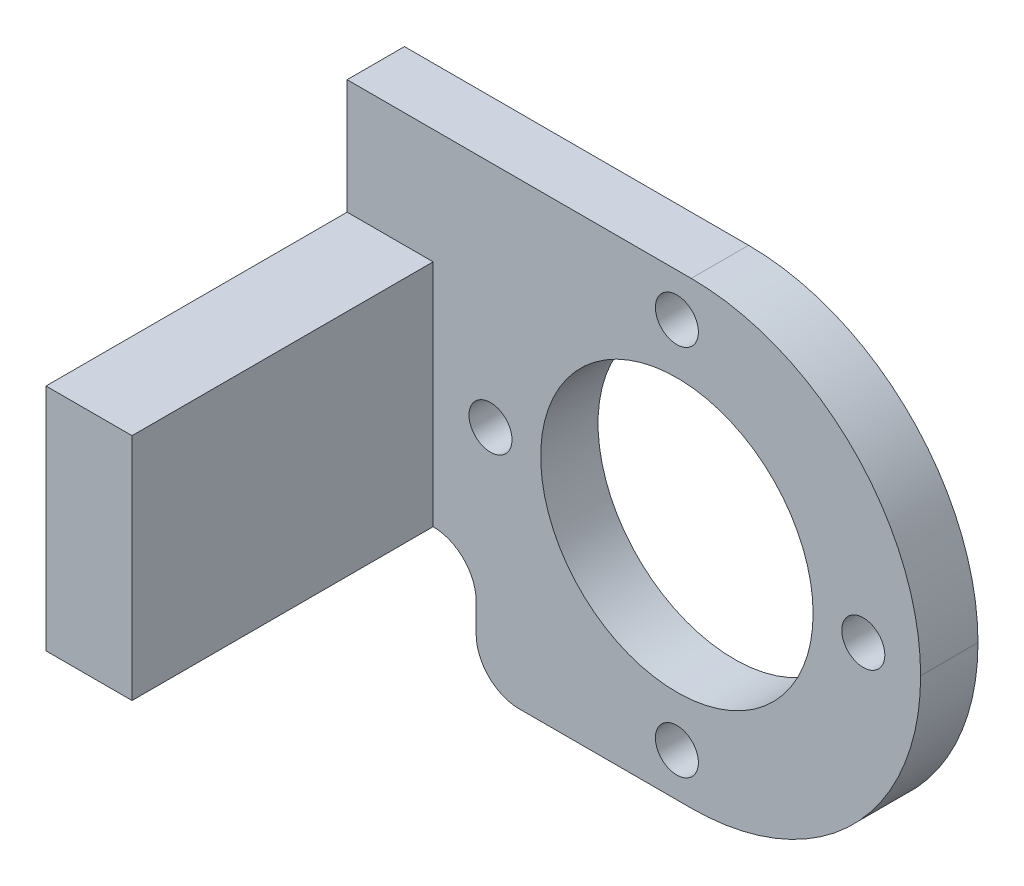
from build123d import *

# Parameters (mm, degrees)
BOSS_EXTRUDE1_DEPTH      = 16
SKETCH2_W                = 21
SKETCH2_H                = 8
CUT_EXTRUDE1_DEPTH       = 44.0464865
SKETCH3_R                = 9.5
CUT_EXTRUDE2_DEPTH       = 36.0142828
FILLET1_R                = 16
F_3_0_3_DIAMETER_HOLE1_D = 3
SKETCH6_W                = 9
SKETCH6_H                = 8
CUT_EXTRUDE3_DEPTH       = 36.0142828
FILLET2_R                = 3


with BuildPart() as part:
    # Sketch1 → Boss-Extrude1 (new, symmetric)
    with BuildSketch(Plane(origin=(0, 0, 0), x_dir=(1, 0, 0), z_dir=(0, 1, 0))):
        Polygon((-17, 0), (17, 0), (17, 4), (-23, 4), (-23, -21), (-17, -21), align=None)
    extrude(amount=BOSS_EXTRUDE1_DEPTH, both=True)

    # Sketch2 → Cut-Extrude1 (cut, through all)
    with BuildSketch(Plane(origin=(-17, 0, 0), x_dir=(0, 0, -1), z_dir=(1, 0, 0))):
        with Locations((-10.5, 12)):
            Rectangle(SKETCH2_W, SKETCH2_H)
        with Locations((-10.5, -12)):
            Rectangle(SKETCH2_W, SKETCH2_H)
    extrude(amount=-CUT_EXTRUDE1_DEPTH, mode=Mode.SUBTRACT)

    # Sketch3 → Cut-Extrude2 (cut, through all)
    with BuildSketch(Plane.XY):
        Circle(SKETCH3_R)
    extrude(amount=-CUT_EXTRUDE2_DEPTH, mode=Mode.SUBTRACT)

    # Fillet1
    fillet1_edges = [part.edges().sort_by_distance(p)[0] for p in [
        (17, -16, -2),
        (17, 16, -2),
    ]]
    fillet(fillet1_edges, radius=FILLET1_R - 0.0001)  # a hair under: the kernel refuses the full size

    # Ø3.0 (3) Diameter Hole1 (through all)
    with Locations(Plane(origin=(0, 0, -4), x_dir=(-1, 0, 0), z_dir=(0, 0, -1))):
        with Locations((0, 13), (13, 0), (0, -13), (-13, 0)):
            Hole(F_3_0_3_DIAMETER_HOLE1_D / 2)

    # Sketch6 → Cut-Extrude3 (cut, through all)
    with BuildSketch(Plane.XY):
        with Locations((-18.5, -12)):
            Rectangle(SKETCH6_W, SKETCH6_H)
    extrude(amount=-CUT_EXTRUDE3_DEPTH, mode=Mode.SUBTRACT)

    # Fillet2
    fillet2_edges = [part.edges().sort_by_distance(p)[0] for p in [
        (-14, -16, -2),
        (-14, -8, -2),
    ]]
    fillet(fillet2_edges, radius=FILLET2_R)


solid = part.part
